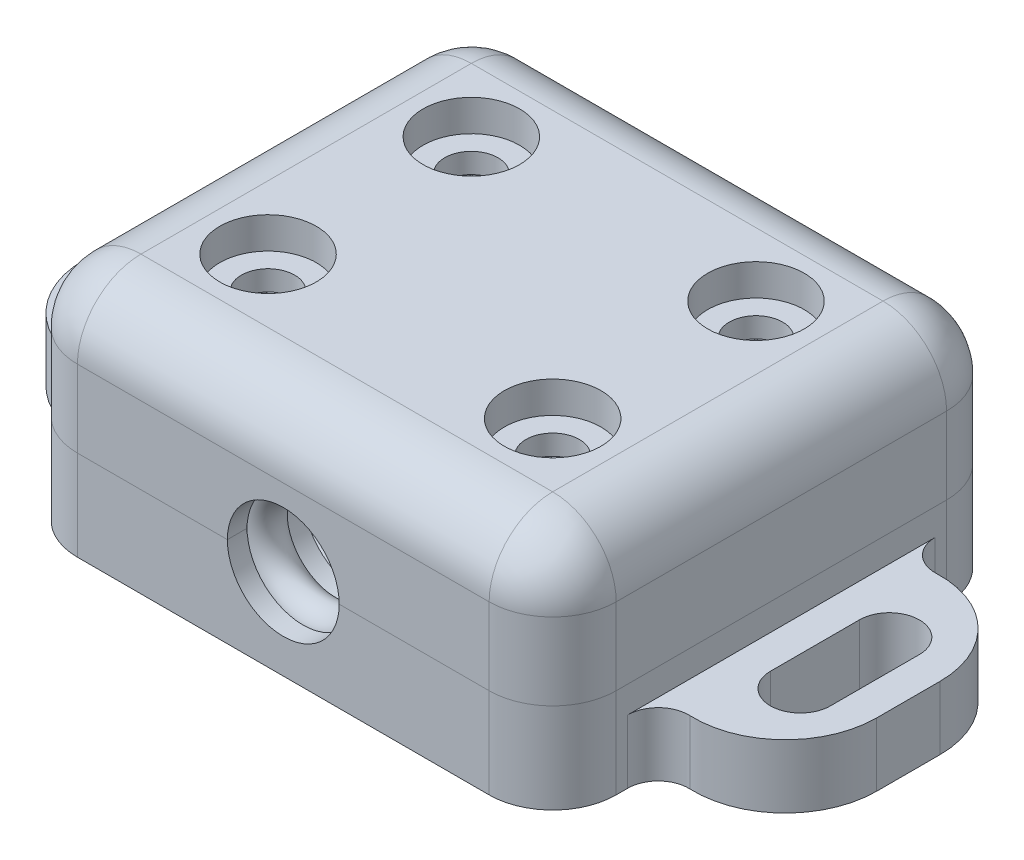
from build123d import *

# Parameters (mm, degrees)
SKETCH1_W                    = 26.924
SKETCH1_H                    = 22.86
SKETCH1_W_2                  = 19.304
SKETCH1_H_2                  = 15.239999999999998
BOSS_EXTRUDE1_DEPTH          = 4.2543
CUT_EXTRUDE1_REACH           = 28.868
SKETCH3_R                    = 2.794
SKETCH2_W                    = 26.92400000000002
SKETCH2_H                    = 22.859999999999996
BOSS_EXTRUDE2_DEPTH          = 0.254
SKETCH16_W                   = 26.924
SKETCH16_H                   = 22.86
BOSS_EXTRUDE7_DEPTH          = 2.7686
SKETCH5_R                    = 0.9525
SKETCH7_R                    = 0.9524999999999987
SKETCH5_2_R                  = 0.9525
SKETCH7_2_R                  = 0.9524999999999987
SKETCH17_W                   = 19.304
SKETCH17_H                   = 15.239999999999998
CUT_EXTRUDE6_DEPTH           = 1.5875
SKETCH13_W                   = 19.30400000000001
SKETCH13_H                   = 15.239999999999998
BOSS_EXTRUDE5_DEPTH          = 0.4
BOSS_EXTRUDE4_DEPTH          = 1.000000032
SKETCH11_R                   = 1.3334999999999988
SKETCH11_R_2                 = 1.3334999999999997
CUT_EXTRUDE2_DEPTH           = 20.128364130948928
SKETCH12_R                   = 2.4129999999999985
SKETCH12_R_2                 = 2.413000000000001
CUT_EXTRUDE3_DEPTH           = 1.5748
FILLET2_R                    = 3.175
FILLET3_R                    = 0.508
SKETCH18_W                   = 19.304
SKETCH18_H                   = 15.239999999999998
BOSS_EXTRUDE8_DEPTH          = 1.27
SKETCH19_W                   = 5.08
SKETCH19_H                   = 15.239999999999998
BOSS_EXTRUDE9_DEPTH          = 5.826099866
SKETCH11_2_R                 = 1.3334999999999988
CUT_EXTRUDE5_DEPTH           = 4.572
CUT_EXTRUDE5_DRAFT           = 4.000000000000009
CUT_EXTRUDE5_PROFILE_2_DEPTH = 4.572
CUT_EXTRUDE5_PROFILE_2_DRAFT = 4.000000000000009
SKETCH11_2_R_2               = 1.3334999999999997
CUT_EXTRUDE5_PROFILE_3_DEPTH = 4.572
CUT_EXTRUDE5_PROFILE_3_DRAFT = 4.000000000000009
CUT_EXTRUDE5_PROFILE_4_DEPTH = 4.572
CUT_EXTRUDE5_PROFILE_4_DRAFT = 4.000000000000009
FILLET5_R                    = 3.175
BOSS_EXTRUDE6_DEPTH          = 3.175


with BuildPart() as part:
    # Sketch1 → Boss-Extrude1 (new body)
    with BuildSketch(Plane(origin=(0, 0, 0), x_dir=(1, 0, 0), z_dir=(0, 1, 0))):
        Rectangle(SKETCH1_W, SKETCH1_H)
        Rectangle(SKETCH1_W_2, SKETCH1_H_2, mode=Mode.SUBTRACT)
    extrude(amount=BOSS_EXTRUDE1_DEPTH)

    # Sketch3 → Cut-Extrude1 (cut, up to next)
    with BuildSketch(Plane.XY.offset(11.429999999999998), mode=Mode.PRIVATE) as cut_extrude1_sk1:
        with Locations((-6.94e-15, 4.2543)):
            Circle(SKETCH3_R)
    cut_extrude1_tool1 = extrude(cut_extrude1_sk1.sketch, amount=-CUT_EXTRUDE1_REACH, mode=Mode.PRIVATE) & part.part
    add(cut_extrude1_tool1.solids().sort_by_distance((0, 4.2543, 11.43))[0], mode=Mode.SUBTRACT)


with BuildPart() as body_2:
    # Mirror1: mirrored copy
    add(part.part.mirror(Plane(origin=(0, 4.2543, 0), x_dir=(0, 0, 1), z_dir=(0, -1, 0))))

    # Sketch16 → Boss-Extrude7 (add)
    with BuildSketch(Plane(origin=(0, 8.5086, 0), x_dir=(1, 0, 0), z_dir=(0, 1, 0))):
        Rectangle(SKETCH16_W, SKETCH16_H)
    extrude(amount=BOSS_EXTRUDE7_DEPTH)


with BuildPart() as part_1:
    add(part.part)

    # Sketch2 → Boss-Extrude2 (add)
    with BuildSketch(Plane.XZ):
        Rectangle(SKETCH2_W, SKETCH2_H)
    extrude(amount=BOSS_EXTRUDE2_DEPTH)


with BuildPart() as cut_sweep2_tool:
    # Cut-Sweep2: sweep along a path in Sketch6
    with BuildLine(Plane(origin=(0, 4.2543, 0), x_dir=(1, 0, 0), z_dir=(0, 1, 0))) as cut_sweep2_path:
        Line((-11.557000000000004, 8.254999999999999), (-11.557000000000004, -8.254999999999997))
        ThreePointArc((-11.557000000000004, -8.254999999999997), (-11.185025612106918, -9.153025612106914), (-10.287, -9.524999999999999))
        Line((-10.287, -9.524999999999999), (10.286999999999994, -9.524999999999997))
        ThreePointArc((10.286999999999994, -9.524999999999997), (11.185025612106909, -9.153025612106912), (11.556999999999995, -8.254999999999997))
        Line((11.556999999999995, -8.254999999999997), (11.556999999999995, 8.255))
        ThreePointArc((11.556999999999995, 8.255), (11.18502561210691, 9.153025612106918), (10.286999999999994, 9.525))
        Line((10.286999999999994, 9.525), (-10.287000000000004, 9.524999999999999))
        ThreePointArc((-10.287000000000004, 9.524999999999999), (-11.18502561210692, 9.153025612106914), (-11.557000000000004, 8.254999999999999))
    # Sketch5 → Cut-Sweep2 (sweep)
    with BuildSketch(Plane.ZY.offset(-2.7939999999999925)):
        with Locations((9.524999999999997, 4.2543)):
            Circle(SKETCH5_R)
    sweep(path=cut_sweep2_path.line)


with BuildPart() as part_2:
    add(part_1.part)

    # Cut-Sweep2: cut by cut_sweep2_tool
    add(cut_sweep2_tool.part, mode=Mode.SUBTRACT)


with BuildPart() as body_2_1:
    add(body_2.part)

    # Cut-Sweep2: cut by cut_sweep2_tool
    add(cut_sweep2_tool.part, mode=Mode.SUBTRACT)


with BuildPart() as cut_revolve1_tool:
    # Sketch7 → Cut-Revolve1 (revolve)
    with BuildSketch(Plane(origin=(0, 4.2543, 0), x_dir=(1, 0, 0), z_dir=(0, 1, 0))):
        with Locations((3.047999999999994, -9.524999999999997)):
            Circle(SKETCH7_R)
    revolve(axis=Axis((-6.94e-15, 4.2543, 7.6199999999999966), (0, 0, 1)))


with BuildPart() as part_3:
    add(part_2.part)

    # Cut-Revolve1: cut by cut_revolve1_tool
    add(cut_revolve1_tool.part, mode=Mode.SUBTRACT)

    # Sketch18 → Boss-Extrude8 (add)
    with BuildSketch(Plane(origin=(0, 0, 0), x_dir=(1, 0, 0), z_dir=(0, 1, 0))):
        Rectangle(SKETCH18_W, SKETCH18_H)
    extrude(amount=BOSS_EXTRUDE8_DEPTH)

    # Sketch19 → Boss-Extrude9 (add)
    with BuildSketch(Plane(origin=(0, 1.27, 0), x_dir=(1, 0, 0), z_dir=(0, 1, 0))):
        with Locations((7.111999999999994, 8.9e-16)):
            Rectangle(SKETCH19_W, SKETCH19_H)
        Polygon((-4.571999999999992, -7.619999999999999), (-4.571999999999996, 7.62), (-9.651999999999997, 7.619999999999999), (-9.65199999999999, -7.619999999999999), align=None)
    extrude(amount=BOSS_EXTRUDE9_DEPTH)


with BuildPart() as body_2_2:
    add(body_2_1.part)

    # Cut-Revolve1: cut by cut_revolve1_tool
    add(cut_revolve1_tool.part, mode=Mode.SUBTRACT)

    # Sketch17 → Cut-Extrude6 (cut)
    with BuildSketch(Plane.XZ.offset(-8.5086)):
        Rectangle(SKETCH17_W, SKETCH17_H)
    extrude(amount=-CUT_EXTRUDE6_DEPTH, mode=Mode.SUBTRACT)

    # Sketch13 → Boss-Extrude5 (add)
    with BuildSketch(Plane.XZ.offset(-10.0961)):
        Rectangle(SKETCH13_W, SKETCH13_H)
    extrude(amount=BOSS_EXTRUDE5_DEPTH)

    # Sketch10 → Boss-Extrude4 (add)
    with BuildSketch(Plane.XZ.offset(-9.696100000000001)):
        with BuildLine():
            Line((7.111999999999993, -2.032), (9.651999999999994, -2.032000000000001))
            Line((9.651999999999994, -2.032000000000001), (9.651999999999994, -7.62))
            Line((9.651999999999994, -7.62), (4.063999999999994, -7.62))
            Line((4.063999999999994, -7.62), (4.063999999999991, -5.08))
            ThreePointArc((4.063999999999991, -5.08), (4.9567385309433964, -2.924738530943403), (7.111999999999993, -2.032))
        make_face()
        with BuildLine():
            Line((-9.65199999999999, -7.620000000000003), (-9.651999999999994, -2.032000000000003))
            Line((-9.651999999999994, -2.032000000000003), (-7.111999999999993, -2.032000000000002))
            ThreePointArc((-7.111999999999993, -2.032000000000002), (-4.956738530943396, -2.924738530943404), (-4.063999999999989, -5.080000000000001))
            Line((-4.063999999999989, -5.080000000000001), (-4.063999999999992, -7.620000000000001))
            Line((-4.063999999999992, -7.620000000000001), (-9.65199999999999, -7.620000000000003))
        make_face()
        with BuildLine():
            Line((-7.111999999999992, 2.032), (-9.651999999999994, 2.0320000000000014))
            Line((-9.651999999999994, 2.0320000000000014), (-9.651999999999996, 7.619999999999999))
            Line((-9.651999999999996, 7.619999999999999), (-4.063999999999994, 7.620000000000001))
            Line((-4.063999999999994, 7.620000000000001), (-4.063999999999992, 5.080000000000001))
            ThreePointArc((-4.063999999999992, 5.080000000000001), (-4.956738530943396, 2.9247385309434035), (-7.111999999999992, 2.032))
        make_face()
        with BuildLine():
            Line((9.651999999999992, 7.620000000000002), (9.651999999999994, 2.0320000000000036))
            Line((9.651999999999994, 2.0320000000000036), (7.111999999999992, 2.032000000000002))
            ThreePointArc((7.111999999999992, 2.032000000000002), (4.956738530943396, 2.924738530943405), (4.06399999999999, 5.080000000000002))
            Line((4.06399999999999, 5.080000000000002), (4.063999999999992, 7.620000000000002))
            Line((4.063999999999992, 7.620000000000002), (9.651999999999992, 7.620000000000002))
        make_face()
    extrude(amount=BOSS_EXTRUDE4_DEPTH)

    # Sketch11 → Cut-Extrude2 (cut, through all)
    with BuildSketch(Plane.XZ.offset(-7.096099866)):
        with Locations(Location((7.111999999999992, 5.080000000000002, 0), (0, 0, 270))):
            Circle(SKETCH11_R)
        with Locations(Location((7.111999999999992, -5.080000000000002, 0), (0, 0, 270))):
            Circle(SKETCH11_R)
        with Locations(Location((-7.111999999999992, 5.080000000000002, 0), (0, 0, 270))):
            Circle(SKETCH11_R_2)
        with Locations(Location((-7.111999999999992, -5.080000000000002, 0), (0, 0, 270))):
            Circle(SKETCH11_R_2)
    extrude(amount=-CUT_EXTRUDE2_DEPTH, mode=Mode.SUBTRACT)

    # Sketch12 → Cut-Extrude3 (cut)
    with BuildSketch(Plane(origin=(0, 11.277199999999999, 0), x_dir=(1, 0, 0), z_dir=(0, 1, 0))):
        with Locations(Location((-7.111999999999992, -5.080000000000002, 0), (0, 0, 270))):
            Circle(SKETCH12_R)
        with Locations(Location((-7.111999999999993, 5.08, 0), (0, 0, 90))):
            Circle(SKETCH12_R)
        with Locations(Location((7.111999999999994, -5.08, 0), (0, 0, 90))):
            Circle(SKETCH12_R_2)
        with Locations(Location((7.111999999999991, 5.080000000000002, 0), (0, 0, 270))):
            Circle(SKETCH12_R)
    extrude(amount=-CUT_EXTRUDE3_DEPTH, mode=Mode.SUBTRACT)

    # Fillet2
    fillet2_edges = [body_2_2.edges().sort_by_distance(p)[0] for p in [
        (-7.11e-15, 11.2772, 11.429999999999998),
        (13.461999999999994, 11.2772, -1.78e-15),
        (-7.11e-15, 11.2772, -11.430000000000001),
        (-13.462000000000009, 11.2772, -1.78e-15),
        (13.461999999999994, 7.765750000000001, 11.429999999999998),
        (-13.462000000000009, 7.765750000000001, 11.429999999999998),
        (-13.462000000000009, 7.765750000000001, -11.430000000000001),
        (13.461999999999994, 7.765750000000001, -11.430000000000001),
    ]]
    fillet(fillet2_edges, radius=FILLET2_R)

    # Fillet3
    fillet3_edges = [body_2_2.edges().sort_by_distance(p)[0] for p in [
        (8.381999999999994, 9.696100000000001, -2.0320000000000005),
        (4.956738530943396, 9.696100000000001, -2.9247385309434035),
        (4.063999999999993, 9.696100000000001, -6.35),
        (-4.956738530943396, 9.696100000000001, -2.9247385309434044),
        (-8.381999999999994, 9.696100000000001, -2.0320000000000022),
        (-4.063999999999991, 9.696100000000001, -6.350000000000001),
        (-4.956738530943396, 9.696100000000001, 2.9247385309434044),
        (-4.063999999999993, 9.696100000000001, 6.350000000000001),
        (-8.381999999999993, 9.696100000000001, 2.032000000000001),
        (4.956738530943396, 9.696100000000001, 2.9247385309434057),
        (8.381999999999993, 9.696100000000001, 2.0320000000000027),
        (4.063999999999991, 9.696100000000001, 6.350000000000001),
    ]]
    fillet(fillet3_edges, radius=FILLET3_R)


with BuildPart() as body_3:
    # Sweep1: sweep along a path in Sketch4
    with BuildLine(Plane(origin=(0, 4.2543, 0), x_dir=(1, 0, 0), z_dir=(0, 1, 0))) as sweep1_path:
        Line((2.7939999999999925, -9.524999999999997), (10.286999999999994, -9.524999999999997))
        ThreePointArc((10.286999999999994, -9.524999999999997), (11.185025612106909, -9.153025612106912), (11.556999999999995, -8.254999999999997))
        Line((11.556999999999995, -8.254999999999997), (11.556999999999995, 8.255))
        ThreePointArc((11.556999999999995, 8.255), (11.18502561210691, 9.153025612106918), (10.286999999999994, 9.525))
        Line((10.286999999999994, 9.525), (-10.287000000000004, 9.524999999999999))
        ThreePointArc((-10.287000000000004, 9.524999999999999), (-11.18502561210692, 9.153025612106914), (-11.557000000000004, 8.254999999999999))
        Line((-11.557000000000004, 8.254999999999999), (-11.557000000000004, -8.254999999999997))
        ThreePointArc((-11.557000000000004, -8.254999999999997), (-11.185025612106918, -9.153025612106914), (-10.287, -9.524999999999997))
        Line((-10.287, -9.524999999999997), (-2.7940000000000063, -9.524999999999997))
    # Sketch5<2> → Sweep1 (sweep)
    with BuildSketch(Plane.ZY.offset(-2.7939999999999925)):
        with Locations((9.524999999999997, 4.2543)):
            Circle(SKETCH5_2_R)
    sweep(path=sweep1_path.line)

    # Sketch7<2> → Revolve1 (revolve)
    with BuildSketch(Plane(origin=(0, 4.2543, 0), x_dir=(1, 0, 0), z_dir=(0, 1, 0)), mode=Mode.PRIVATE) as revolve1_sk:
        with Locations((3.047999999999994, -9.524999999999997)):
            Circle(SKETCH7_2_R)
    revolve(revolve1_sk.sketch.rotate(Axis((-6.94e-15, 4.2543, 7.6199999999999966), (0, 0, 1)), 270), axis=Axis((-6.94e-15, 4.2543, 7.6199999999999966), (0, 0, 1)))


with BuildPart() as cut_extrude5_tool:
    # Sketch11<2> → Cut-Extrude5 (with draft: the straight prism first)
    with BuildSketch(Plane.XZ.offset(-7.096099866)):
        with Locations(Location((7.111999999999992, 5.080000000000002, 0), (0, 0, 270))):
            Circle(SKETCH11_2_R)
    extrude(amount=CUT_EXTRUDE5_DEPTH)
    # Cut-Extrude5: the draft: its side faces are tilted about the plane it starts from
    cut_extrude5_sides = [cut_extrude5_tool.faces().sort_by_distance(p)[0] for p in [
        (7.112, 4.810099866, 6.4135),
    ]]
    draft(cut_extrude5_sides, Plane.XZ.offset(-7.096099866), CUT_EXTRUDE5_DRAFT)


with BuildPart() as part_4:
    add(part_3.part)

    # Cut-Extrude5: cut by cut_extrude5_tool
    add(cut_extrude5_tool.part, mode=Mode.SUBTRACT)


with BuildPart() as cut_extrude5_profile_2_tool:
    # Sketch11<2> → Cut-Extrude5 profile 2 (with draft: the straight prism first)
    with BuildSketch(Plane.XZ.offset(-7.096099866)):
        with Locations(Location((7.111999999999992, -5.080000000000002, 0), (0, 0, 270))):
            Circle(SKETCH11_2_R)
    extrude(amount=CUT_EXTRUDE5_PROFILE_2_DEPTH)
    # Cut-Extrude5 profile 2: the draft: its side faces are tilted about the plane it starts from
    cut_extrude5_profile_2_sides = [cut_extrude5_profile_2_tool.faces().sort_by_distance(p)[0] for p in [
        (7.112, 4.810099866, -3.7465),
    ]]
    draft(cut_extrude5_profile_2_sides, Plane.XZ.offset(-7.096099866), CUT_EXTRUDE5_PROFILE_2_DRAFT)


with BuildPart() as part_5:
    add(part_4.part)

    # Cut-Extrude5 profile 2: cut by cut_extrude5_profile_2_tool
    add(cut_extrude5_profile_2_tool.part, mode=Mode.SUBTRACT)


with BuildPart() as cut_extrude5_profile_3_tool:
    # Sketch11<2> → Cut-Extrude5 profile 3 (with draft: the straight prism first)
    with BuildSketch(Plane.XZ.offset(-7.096099866)):
        with Locations(Location((-7.111999999999992, 5.080000000000002, 0), (0, 0, 270))):
            Circle(SKETCH11_2_R_2)
    extrude(amount=CUT_EXTRUDE5_PROFILE_3_DEPTH)
    # Cut-Extrude5 profile 3: the draft: its side faces are tilted about the plane it starts from
    cut_extrude5_profile_3_sides = [cut_extrude5_profile_3_tool.faces().sort_by_distance(p)[0] for p in [
        (-7.112, 4.810099866, 6.4135),
    ]]
    draft(cut_extrude5_profile_3_sides, Plane.XZ.offset(-7.096099866), CUT_EXTRUDE5_PROFILE_3_DRAFT)


with BuildPart() as part_6:
    add(part_5.part)

    # Cut-Extrude5 profile 3: cut by cut_extrude5_profile_3_tool
    add(cut_extrude5_profile_3_tool.part, mode=Mode.SUBTRACT)


with BuildPart() as cut_extrude5_profile_4_tool:
    # Sketch11<2> → Cut-Extrude5 profile 4 (with draft: the straight prism first)
    with BuildSketch(Plane.XZ.offset(-7.096099866)):
        with Locations(Location((-7.111999999999992, -5.080000000000002, 0), (0, 0, 270))):
            Circle(SKETCH11_2_R_2)
    extrude(amount=CUT_EXTRUDE5_PROFILE_4_DEPTH)
    # Cut-Extrude5 profile 4: the draft: its side faces are tilted about the plane it starts from
    cut_extrude5_profile_4_sides = [cut_extrude5_profile_4_tool.faces().sort_by_distance(p)[0] for p in [
        (-7.112, 4.810099866, -3.7465),
    ]]
    draft(cut_extrude5_profile_4_sides, Plane.XZ.offset(-7.096099866), CUT_EXTRUDE5_PROFILE_4_DRAFT)


with BuildPart() as part_7:
    add(part_6.part)

    # Cut-Extrude5 profile 4: cut by cut_extrude5_profile_4_tool
    add(cut_extrude5_profile_4_tool.part, mode=Mode.SUBTRACT)

    # Fillet5
    fillet5_edges = [part_7.edges().sort_by_distance(p)[0] for p in [
        (13.462000000000003, 2.00015, 11.429999999999998),
        (-13.462000000000009, 2.0001499999999997, 11.429999999999998),
        (-13.462000000000009, 2.0001499999999997, -11.43),
        (13.462000000000003, 2.00015, -11.43),
    ]]
    fillet(fillet5_edges, radius=FILLET5_R)

    # Sketch14 → Boss-Extrude6 (add)
    # profile 1 of 2: a face of its own
    with BuildSketch(Plane.XZ.offset(0.254)):
        with BuildLine():
            Line((13.462000000000012, 7.678206034607154), (13.462000000000012, -7.678206034607154))
            ThreePointArc((13.462000000000012, -7.678206034607154), (13.931058769409415, -6.57835377180092), (15.049500000000007, -6.155529525955365))
            ThreePointArc((15.049500000000007, -6.155529525955365), (18.404823691771796, -4.887056788418713), (19.812000000000012, -1.5875))
            Line((19.812000000000012, -1.5875), (19.812000000000012, 1.5875))
            ThreePointArc((19.812000000000012, 1.5875), (18.404823691771796, 4.887056788418713), (15.049500000000007, 6.155529525955365))
            ThreePointArc((15.049500000000007, 6.155529525955365), (13.931058769409415, 6.57835377180092), (13.462000000000012, 7.678206034607154))
        make_face()
        with BuildLine():
            Line((18.137000000000015, 2.2224999999999997), (18.137000000000015, -2.2224999999999997))
            ThreePointArc((18.137000000000015, -2.2224999999999997), (16.637000000000015, -3.7225000000000033), (15.137000000000011, -2.2224999999999993))
            Line((15.137000000000011, -2.2224999999999993), (15.137000000000011, 2.2224999999999993))
            ThreePointArc((15.137000000000011, 2.2224999999999993), (16.637000000000015, 3.7224999999999997), (18.137000000000015, 2.2224999999999997))
        make_face(mode=Mode.SUBTRACT)
    # profile 2 of 2: a face of its own
    with BuildSketch(Plane.XZ.offset(0.254)):
        with BuildLine():
            Line((-19.812000000000012, -1.5875), (-19.812000000000012, 1.5875))
            ThreePointArc((-19.812000000000012, 1.5875), (-18.404823691771796, 4.887056788418713), (-15.049500000000007, 6.155529525955365))
            ThreePointArc((-15.049500000000007, 6.155529525955365), (-13.931058769409415, 6.57835377180092), (-13.462000000000012, 7.678206034607154))
            Line((-13.462000000000012, 7.678206034607154), (-13.462000000000012, -7.678206034607154))
            ThreePointArc((-13.462000000000012, -7.678206034607154), (-13.931058769409415, -6.57835377180092), (-15.049500000000007, -6.155529525955365))
            ThreePointArc((-15.049500000000007, -6.155529525955365), (-18.404823691771796, -4.887056788418713), (-19.812000000000012, -1.5875))
        make_face()
        with BuildLine():
            Line((-18.137000000000015, 2.2224999999999997), (-18.137000000000015, -2.2224999999999997))
            ThreePointArc((-18.137000000000015, -2.2224999999999997), (-16.637000000000015, -3.7225000000000033), (-15.137000000000011, -2.2224999999999993))
            Line((-15.137000000000011, -2.2224999999999993), (-15.137000000000011, 2.2224999999999993))
            ThreePointArc((-15.137000000000011, 2.2224999999999993), (-16.637000000000015, 3.7224999999999997), (-18.137000000000015, 2.2224999999999997))
        make_face(mode=Mode.SUBTRACT)
    extrude(amount=-BOSS_EXTRUDE6_DEPTH)


solid = Compound([body_2_2.part, body_3.part, part_7.part])
